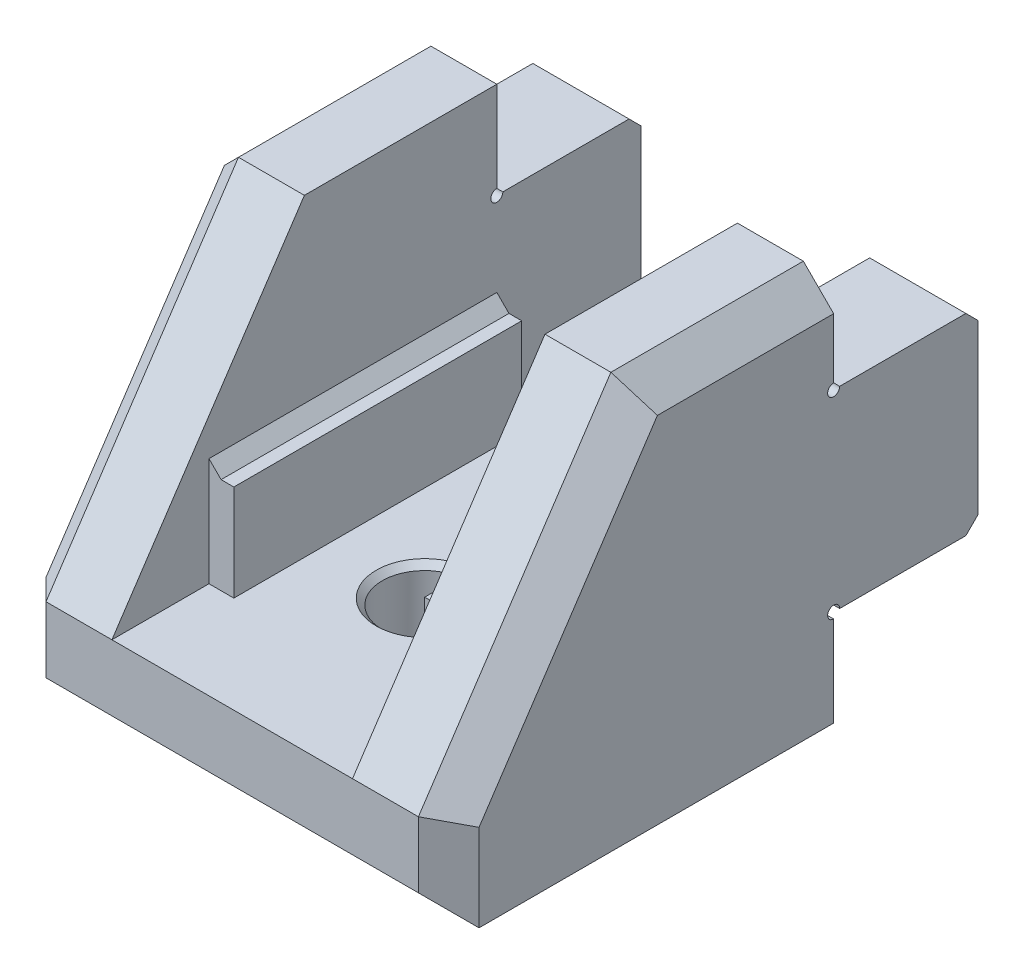
from build123d import *

# Parameters (mm, degrees)
SKETCH1_W                  = 7.9375
SKETCH1_H                  = 12.7
BOSS_EXTRUDE1_DEPTH        = 3.175
SKETCH1_3_W                = 3.175
SKETCH1_3_H                = 12.7
BOSS_EXTRUDE2_DEPTH        = 12.7
CUT_EXTRUDE2_DEPTH         = 21.143116845
SKETCH3_W                  = 0.82075
SKETCH3_H                  = 9.498
BOSS_EXTRUDE3_DEPTH        = 3.175
SKETCH4_W                  = 3.175
SKETCH4_H                  = 6.35
BOSS_EXTRUDE4_DEPTH        = 4.7625
SKETCH5_R                  = 0.1984375
CUT_EXTRUDE3_DEPTH         = 23.11131639
CHAMFER1_SIZE              = 0.4
CHAMFER2_SIZE              = 1
F_35_0_11_DIAMETER_HOLE1_D = 2.794
CHAMFER3_SIZE              = 0.2


with BuildPart() as part:
    # Sketch1 → Boss-Extrude1 (new body)
    with BuildSketch(Plane(origin=(0, 0, 0), x_dir=(1, 0, 0), z_dir=(0, 1, 0))):
        Rectangle(SKETCH1_W, SKETCH1_H)
    extrude(amount=BOSS_EXTRUDE1_DEPTH)

    # Sketch1<3> → Boss-Extrude2 (add)
    with BuildSketch(Plane(origin=(0, 0, 0), x_dir=(1, 0, 0), z_dir=(0, 1, 0))):
        with Locations((5.55625, 0)):
            Rectangle(SKETCH1_3_W, SKETCH1_3_H)
        with Locations((-5.55625, 0)):
            Rectangle(SKETCH1_3_W, SKETCH1_3_H)
    extrude(amount=BOSS_EXTRUDE2_DEPTH)

    # Sketch2 → Cut-Extrude2 (cut, through all)
    with BuildSketch(Plane(origin=(7.14375, 0, 0), x_dir=(0, 0, -1), z_dir=(1, 0, 0))):
        Polygon((-6.35, 3.175), (0, 12.7), (-6.35, 12.7), align=None)
    extrude(amount=-CUT_EXTRUDE2_DEPTH, mode=Mode.SUBTRACT)

    # Sketch3 → Boss-Extrude3 (add)
    with BuildSketch(Plane(origin=(0, 3.175, 0), x_dir=(1, 0, 0), z_dir=(0, 1, 0))):
        with Locations((-3.558375, 1.601)):
            Rectangle(SKETCH3_W, SKETCH3_H)
        with Locations((3.558375, 1.601)):
            Rectangle(SKETCH3_W, SKETCH3_H)
    extrude(amount=BOSS_EXTRUDE3_DEPTH)

    # Sketch4 → Boss-Extrude4 (add)
    with BuildSketch(Plane(origin=(0, 0, -6.35), x_dir=(-1, 0, 0), z_dir=(0, 0, -1))):
        with Locations((-5.55625, 6.35)):
            Rectangle(SKETCH4_W, SKETCH4_H)
        with Locations((5.55625, 6.35)):
            Rectangle(SKETCH4_W, SKETCH4_H)
    extrude(amount=BOSS_EXTRUDE4_DEPTH)

    # Sketch5 → Cut-Extrude3 (cut, through all)
    with BuildSketch(Plane(origin=(7.14375, 0, 0), x_dir=(0, 0, -1), z_dir=(1, 0, 0))):
        with Locations((6.35, 9.525)):
            Circle(SKETCH5_R)
        with Locations((6.35, 3.175)):
            Circle(SKETCH5_R)
    extrude(amount=-CUT_EXTRUDE3_DEPTH, mode=Mode.SUBTRACT)

    # Chamfer1
    chamfer1_edges = [part.edges().sort_by_distance(p)[0] for p in [
        (-5.55625, 9.525, -11.1125),
        (-5.55625, 3.175, -11.1125),
        (5.55625, 3.175, -11.1125),
        (5.55625, 9.525, -11.1125),
        (3.96875, 6.35, -1.601),
        (-3.96875, 6.35, -1.601),
    ]]
    chamfer(chamfer1_edges, length=CHAMFER1_SIZE)

    # Chamfer2
    chamfer2_edges = [part.edges().sort_by_distance(p)[0] for p in [
        (-7.14375, 12.7, -3.175),
        (7.14375, 12.7, -3.175),
        (7.14375, 7.9375, 3.175),
        (-7.14375, 7.9375, 3.175),
        (-7.14375, 1.5875, 6.35),
        (7.14375, 1.5875, 6.35),
        (0, 0, 6.35),
    ]]
    chamfer(chamfer2_edges, length=CHAMFER2_SIZE)

    # #35 (0.11) Diameter Hole1 (through all)
    with Locations(Plane(origin=(0, 3.175, 0), x_dir=(1, 0, 0), z_dir=(0, 1, 0))):
        with Locations((0, 0)):
            Hole(F_35_0_11_DIAMETER_HOLE1_D / 2)

    # Chamfer3
    chamfer3_edges = [part.edges().sort_by_distance(p)[0] for p in [
        (1.397, 0, 0),
        (1.397, 3.175, 0),
    ]]
    chamfer(chamfer3_edges, length=CHAMFER3_SIZE)


solid = part.part
